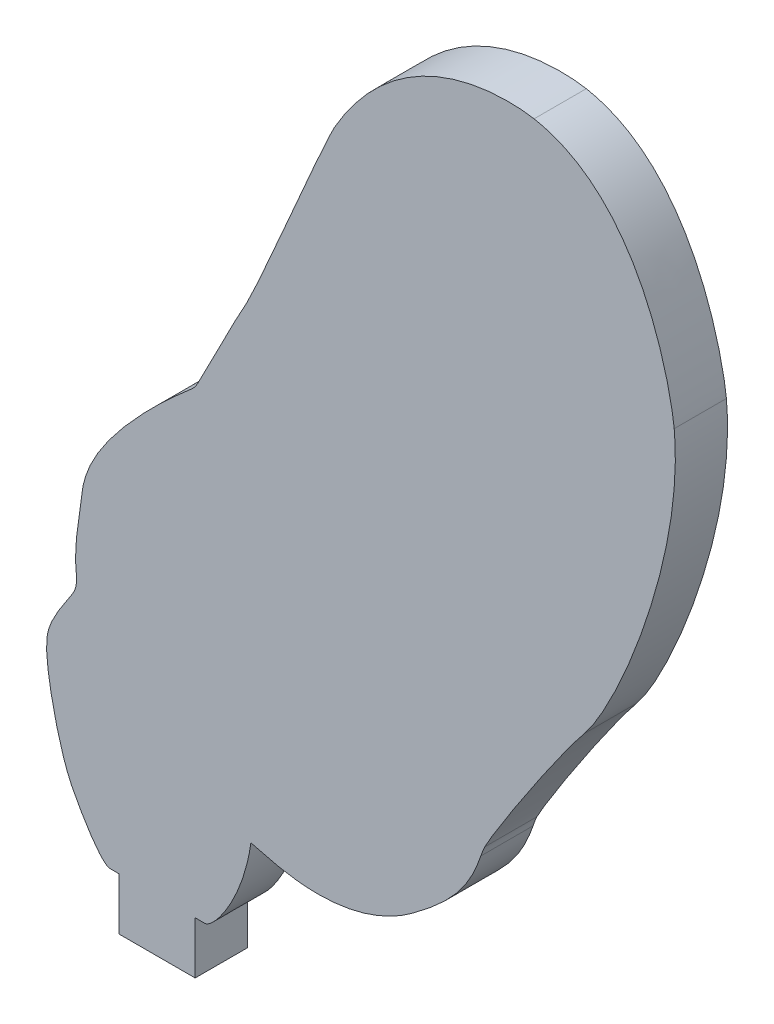
from build123d import *

# Parameters (mm, degrees)
BASE_FLANGE1_DEPTH = 2.3
SKETCH6_W          = 3.35
SKETCH6_H          = 2.3
TAB1_DEPTH         = 2.3


# Sheet-metal steps are written as plain solids
with BuildPart() as part:
    # Model → Base-Flange1 (new body)
    with BuildSketch(Plane.XY):
        with BuildLine():
            Line((248.218742139, -402.267177227), (248.210301655, -402.327638653))
            Line((248.210301655, -402.327638653), (248.222510212, -402.491323752))
            add(Edge.make_bspline(
                [(248.222510212, -402.491323752), (248.246022989, -403.332056241), (248.70901563, -405.763218763), (249.319354503, -407.010912211)],
                knots=[15, 15, 15, 15, 16, 16, 16, 16], degree=3))
            add(Edge.make_bspline(
                [(249.319354503, -407.010912211), (249.523464167, -407.428166136), (250.554572065, -409.330398118), (251.019073512, -409.330398118)],
                knots=[16, 16, 16, 16, 17, 17, 17, 17], degree=3))
            Line((251.019073512, -409.330398118), (255.183497951, -409.330398118))
            add(Edge.make_bspline(
                [(255.183497951, -409.330398118), (255.57849992, -409.330398118), (256.903800339, -407.601307276), (257.216965505, -405.238012255)],
                knots=[18, 18, 18, 18, 19, 19, 19, 19], degree=3))
            add(Edge.make_bspline(
                [(257.216965505, -405.238012255), (257.282443851, -405.253687439), (257.400782881, -405.285511509), (257.476488854, -405.305880636)],
                knots=[19, 19, 19, 19, 20, 20, 20, 20], degree=3))
            add(Edge.make_bspline(
                [(257.476488854, -405.305880636), (258.053585412, -405.461039124), (259.01894423, -405.720627069), (260.177228396, -405.720627069)],
                knots=[20, 20, 20, 20, 21, 21, 21, 21], degree=3))
            add(Edge.make_bspline(
                [(260.177228396, -405.720627069), (261.701597021, -405.720627069), (263.091822241, -405.273152229), (264.309275921, -404.390604893)],
                knots=[21, 21, 21, 21, 22, 22, 22, 22], degree=3))
            add(Edge.make_bspline(
                [(264.309275921, -404.390604893), (266.463709447, -402.828426345), (266.962343955, -401.784562413), (267.352996251, -400.677050342)],
                knots=[22, 22, 22, 22, 23, 23, 23, 23], degree=3))
            add(Edge.make_bspline(
                [(267.352996251, -400.677050342), (267.416579794, -400.496828784), (267.462485692, -400.366647239), (267.523872987, -400.243872648)],
                knots=[23, 23, 23, 23, 24, 24, 24, 24], degree=3))
            add(Edge.make_bspline(
                [(267.523872987, -400.243872648), (267.937370572, -399.417178923), (270.638605347, -395.276389468), (271.926597358, -393.708698768)],
                knots=[24, 24, 24, 24, 25, 25, 25, 25], degree=3))
            add(Edge.make_bspline(
                [(271.926597358, -393.708698768), (273.376056688, -391.944379242), (276.34214037, -385.026811485), (275.876086264, -380.104114983)],
                knots=[25, 25, 25, 25, 26, 26, 26, 26], degree=3))
            add(Edge.make_bspline(
                [(275.876086264, -380.104114983), (275.8417645, -379.564656094), (274.799645491, -372.313924687), (269.70086935, -371.365600484)],
                knots=[0, 0, 0, 0, 1, 1, 1, 1], degree=3))
            add(Edge.make_bspline(
                [(269.70086935, -371.365600484), (269.207450344, -371.273829209), (264.137348452, -370.462620652), (260.904098088, -376.084398314)],
                knots=[1, 1, 1, 1, 2, 2, 2, 2], degree=3))
            add(Edge.make_bspline(
                [(260.904098088, -376.084398314), (260.433751909, -376.902207435), (257.516322771, -383.883501762), (257.032437578, -384.730177041)],
                knots=[2, 2, 2, 2, 3, 3, 3, 3], degree=3))
            add(Edge.make_bspline(
                [(257.032437578, -384.730177041), (256.627208222, -385.439479138), (256.175534672, -386.334514945), (255.738718096, -387.200052122)],
                knots=[3, 3, 3, 3, 4, 4, 4, 4], degree=3))
            add(Edge.make_bspline(
                [(255.738718096, -387.200052122), (255.500946273, -387.671364299), (255.11366392, -388.439088056), (254.863555112, -388.899096881)],
                knots=[4, 4, 4, 4, 5, 5, 5, 5], degree=3))
            add(Edge.make_bspline(
                [(254.863555112, -388.899096881), (254.791907734, -389.030873232), (254.698271896, -389.145280785), (254.58356807, -389.241931628)],
                knots=[5, 5, 5, 5, 6, 6, 6, 6], degree=3))
            add(Edge.make_bspline(
                [(254.58356807, -389.241931628), (254.060651196, -389.68254776), (253.251264748, -390.417536599), (252.487366168, -391.213071598)],
                knots=[6, 6, 6, 6, 7, 7, 7, 7], degree=3))
            add(Edge.make_bspline(
                [(252.487366168, -391.213071598), (250.221699122, -393.572574432), (249.853612202, -394.87055722), (249.773793646, -395.641655717)],
                knots=[7, 7, 7, 7, 8, 8, 8, 8], degree=3))
            add(Edge.make_bspline(
                [(249.773793646, -395.641655717), (249.748472194, -395.887075707), (249.70937036, -396.14291711), (249.667964619, -396.413744679)],
                knots=[8, 8, 8, 8, 9, 9, 9, 9], degree=3))
            add(Edge.make_bspline(
                [(249.667964619, -396.413744679), (249.5552028, -397.150487356), (249.42571589, -397.996549574), (249.530537872, -398.885487222)],
                knots=[9, 9, 9, 9, 10, 10, 10, 10], degree=3))
            add(Edge.make_bspline(
                [(249.530537872, -398.885487222), (249.565005835, -399.177791085), (249.489477062, -399.47455308), (249.322935943, -399.717233208)],
                knots=[10, 10, 10, 10, 11, 11, 11, 11], degree=3))
            add(Edge.make_bspline(
                [(249.322935943, -399.717233208), (248.372080781, -401.102798846), (248.260421691, -401.546272976), (248.227591728, -401.973655092)],
                knots=[11, 11, 11, 11, 12, 12, 12, 12], degree=3))
            add(Edge.make_bspline(
                [(248.227591728, -401.973655092), (248.223328422, -402.029207256), (248.218354566, -402.115851408), (248.218742139, -402.267177227)],
                knots=[12, 12, 12, 12, 13, 13, 13, 13], degree=3))
        make_face()
    extrude(amount=-BASE_FLANGE1_DEPTH)

    # Sketch6 → Tab1 (add)
    with BuildSketch(Plane.XY):
        with Locations((253.086490394, -410.480398118)):
            Rectangle(SKETCH6_W, SKETCH6_H)
    extrude(amount=-TAB1_DEPTH)


solid = part.part
